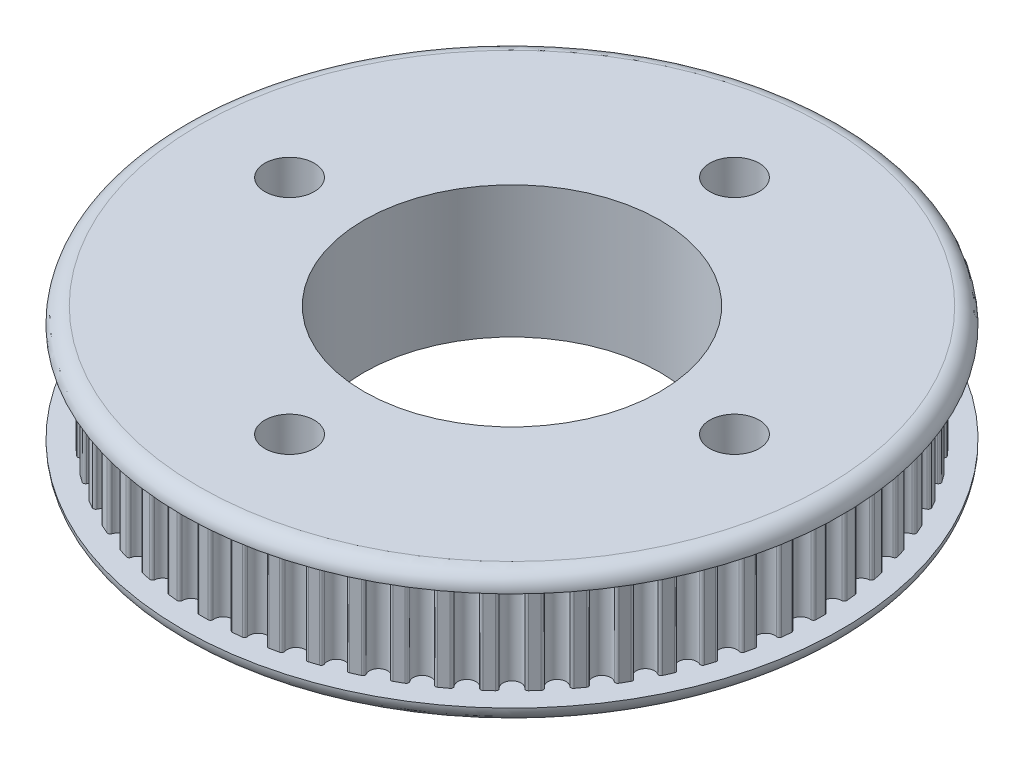
from build123d import *

# Parameters (mm, degrees)
SKETCH1_R           = 19.1
BOSS_EXTRUDE1_DEPTH = 6
CUT_EXTRUDE1_DEPTH  = 6
CIRPATTERN2_DEPTH   = 6
SKETCH3_R           = 1.5
CUT_EXTRUDE2_DEPTH  = 6
SKETCH4_R           = 9
CUT_EXTRUDE3_DEPTH  = 6
SKETCH5_R           = 20
BOSS_EXTRUDE2_DEPTH = 1
FILLET1_R           = 1
SKETCH6_R           = 1.5
SKETCH6_R_2         = 9
CUT_EXTRUDE4_DEPTH  = 1
SKETCH7_R           = 20
BOSS_EXTRUDE3_DEPTH = 1
FILLET2_R           = 1
SKETCH8_R           = 1.5
SKETCH8_R_2         = 9
CUT_EXTRUDE5_DEPTH  = 1


# Read off the part's stored shape, not the designer's step: CirPattern2
with BuildPart() as part:
    # Sketch1 → Boss-Extrude1 (new body)
    with BuildSketch(Plane(origin=(0, 0, 0), x_dir=(1, 0, 0), z_dir=(0, 1, 0))):
        with Locations(Location((0, 0, 0), (0, 0, 270))):
            Circle(SKETCH1_R)
    extrude(amount=BOSS_EXTRUDE1_DEPTH)

    # Sketch2 → Cut-Extrude1 (cut)
    with BuildSketch(Plane(origin=(0, 6, 0), x_dir=(1, 0, 0), z_dir=(0, 1, 0))):
        with BuildLine():
            Line((0, 18.72), (0.273332529, 18.72))
            ThreePointArc((0.273332529, 18.72), (0.384963531, 18.670192412), (0.422460254, 18.553846925))
            ThreePointArc((0.422460254, 18.553846925), (0.940477134, 17.94537274), (1.519259135, 18.496366131))
            ThreePointArc((1.519259135, 18.496366131), (1.568711861, 18.608154791), (1.684937647, 18.646020911))
            Line((1.684937647, 18.646020911), (1.956772832, 18.617449881))
            Line((1.956772832, 18.617449881), (1.996493648, 18.995368202))
            Line((1.996493648, 18.995368202), (1.058746787, 19.07063332))
            Line((1.058746787, 19.07063332), (0.940477134, 19.07683157))
            Line((0.940477134, 19.07683157), (0, 19.1))
            Line((0, 19.1), (0, 18.72))
        make_face()
    extrude(amount=-CUT_EXTRUDE1_DEPTH, mode=Mode.SUBTRACT)


with BuildPart() as cut_extrude1_kept_piece:
    # of the separate pieces the step leaves, the one the design keeps (cut_extrude1_pieces_kept)
    add(part.part.solids().sort_by_distance((0, 0, 19.1))[0])

    # CirPattern2 outline → CirPattern2 (cut)
    with BuildSketch(Plane(origin=(0, 0, 0), x_dir=(1, 0, 0), z_dir=(0, 1, 0))):
        with BuildLine():
            ThreePointArc((-0.422460254, 18.553846925), (-0.384963531, 18.670192412), (-0.273332529, 18.72))
            Line((-0.273332529, 18.72), (0, 18.72))
            Line((0, 18.72), (0, 19.1))
            ThreePointArc((0, 19.1), (-0.999616756, -19.073824114), (1.996493648, 18.995368202))
            Line((1.996493648, 18.995368202), (1.956772832, 18.617449881))
            Line((1.956772832, 18.617449881), (2.228608017, 18.588878852))
            ThreePointArc((2.228608017, 18.588878852), (2.334421183, 18.527675498), (2.359551079, 18.408047889))
            ThreePointArc((2.359551079, 18.408047889), (2.811127337, 17.74875948), (3.444333202, 18.23623528))
            ThreePointArc((3.444333202, 18.23623528), (3.505200118, 18.342242332), (3.624747294, 18.367752114))
            Line((3.624747294, 18.367752114), (4.15946641, 18.254094057))
            ThreePointArc((4.15946641, 18.254094057), (4.258302427, 18.182165494), (4.270790169, 18.060566428))
            ThreePointArc((4.270790169, 18.060566428), (4.650978241, 17.357687098), (5.331670434, 17.776304418))
            ThreePointArc((5.331670434, 17.776304418), (5.403284669, 17.875368427), (5.524843452, 17.888242382))
            Line((5.524843452, 17.888242382), (6.044752818, 17.719313588))
            ThreePointArc((6.044752818, 17.719313588), (6.135528819, 17.63744788), (6.135237588, 17.515209623))
            ThreePointArc((6.135237588, 17.515209623), (6.439872053, 16.776440264), (7.160592769, 17.121612646))
            ThreePointArc((7.160592769, 17.121612646), (7.242169702, 17.212648246), (7.364408268, 17.212745322))
            Line((7.364408268, 17.212745322), (7.863811649, 16.990396612))
            ThreePointArc((7.863811649, 16.990396612), (7.945533073, 16.899490697), (7.93246606, 16.777952515))
            ThreePointArc((7.93246606, 16.777952515), (8.15820928, 16.01138724), (8.911062151, 16.279332902))
            ThreePointArc((8.911062151, 16.279332902), (9.001708008, 16.361342688), (9.123287086, 16.348661824))
            Line((9.123287086, 16.348661824), (9.596712914, 16.075329294))
            ThreePointArc((9.596712914, 16.075329294), (9.668484404, 15.976379156), (9.642784774, 15.856872648))
            ThreePointArc((9.642784774, 15.856872648), (9.787163459, 15.070910106), (10.563900071, 15.25869338))
            ThreePointArc((10.563900071, 15.25869338), (10.662621718, 15.330778836), (10.782209262, 15.305458964))
            Line((10.782209262, 15.305458964), (11.224470584, 14.984137305))
            ThreePointArc((11.224470584, 14.984137305), (11.285505796, 14.878227063), (11.247455121, 14.762061567))
            ThreePointArc((11.247455121, 14.762061567), (11.308887427, 13.965312927), (12.100997692, 14.070876421))
            ThreePointArc((12.100997692, 14.070876421), (12.206713513, 14.132247763), (12.322999296, 14.094566294))
            Line((12.322999296, 14.094566294), (12.729250606, 13.728775972))
            ThreePointArc((12.729250606, 13.728775972), (12.778880826, 13.617066), (12.728895995, 13.505514249))
            ThreePointArc((12.728895995, 13.505514249), (12.706708858, 12.706708858), (13.505514249, 12.728895995))
            ThreePointArc((13.505514249, 12.728895995), (13.617066, 12.778880826), (13.728775972, 12.729250606))
            Line((13.728775972, 12.729250606), (14.094566294, 12.322999296))
            ThreePointArc((14.094566294, 12.322999296), (14.132247763, 12.206713513), (14.070876421, 12.100997692))
            ThreePointArc((14.070876421, 12.100997692), (13.965312927, 11.308887427), (14.762061567, 11.247455121))
            ThreePointArc((14.762061567, 11.247455121), (14.878227063, 11.285505796), (14.984137305, 11.224470584))
            Line((14.984137305, 11.224470584), (15.305458964, 10.782209262))
            ThreePointArc((15.305458964, 10.782209262), (15.330778836, 10.662621718), (15.25869338, 10.563900071))
            ThreePointArc((15.25869338, 10.563900071), (15.070910106, 9.787163459), (15.856872648, 9.642784774))
            ThreePointArc((15.856872648, 9.642784774), (15.976379156, 9.668484404), (16.075329294, 9.596712914))
            Line((16.075329294, 9.596712914), (16.348661824, 9.123287086))
            ThreePointArc((16.348661824, 9.123287086), (16.361342688, 9.001708008), (16.279332902, 8.911062151))
            ThreePointArc((16.279332902, 8.911062151), (16.01138724, 8.15820928), (16.777952515, 7.93246606))
            ThreePointArc((16.777952515, 7.93246606), (16.899490697, 7.945533073), (16.990396612, 7.863811649))
            Line((16.990396612, 7.863811649), (17.212745322, 7.364408268))
            ThreePointArc((17.212745322, 7.364408268), (17.212648246, 7.242169702), (17.121612646, 7.160592769))
            ThreePointArc((17.121612646, 7.160592769), (16.776440264, 6.439872053), (17.515209623, 6.135237588))
            ThreePointArc((17.515209623, 6.135237588), (17.63744788, 6.135528819), (17.719313588, 6.044752818))
            Line((17.719313588, 6.044752818), (17.888242382, 5.524843452))
            ThreePointArc((17.888242382, 5.524843452), (17.875368427, 5.403284669), (17.776304418, 5.331670434))
            ThreePointArc((17.776304418, 5.331670434), (17.357687098, 4.650978241), (18.060566428, 4.270790169))
            ThreePointArc((18.060566428, 4.270790169), (18.182165494, 4.258302427), (18.254094057, 4.15946641))
            Line((18.254094057, 4.15946641), (18.367752114, 3.624747294))
            ThreePointArc((18.367752114, 3.624747294), (18.342242332, 3.505200118), (18.23623528, 3.444333202))
            ThreePointArc((18.23623528, 3.444333202), (17.74875948, 2.811127337), (18.408047889, 2.359551079))
            ThreePointArc((18.408047889, 2.359551079), (18.527675498, 2.334421183), (18.588878852, 2.228608017))
            Line((18.588878852, 2.228608017), (18.646020911, 1.684937647))
            ThreePointArc((18.646020911, 1.684937647), (18.608154791, 1.568711861), (18.496366131, 1.519259135))
            ThreePointArc((18.496366131, 1.519259135), (17.94537274, 0.940477134), (18.553846925, 0.422460254))
            ThreePointArc((18.553846925, 0.422460254), (18.670192412, 0.384963531), (18.72, 0.273332529))
            Line((18.72, 0.273332529), (18.72, -0.273332529))
            ThreePointArc((18.72, -0.273332529), (18.670192412, -0.384963531), (18.553846925, -0.422460254))
            ThreePointArc((18.553846925, -0.422460254), (17.94537274, -0.940477134), (18.496366131, -1.519259135))
            ThreePointArc((18.496366131, -1.519259135), (18.608154791, -1.568711861), (18.646020911, -1.684937647))
            Line((18.646020911, -1.684937647), (18.588878852, -2.228608017))
            ThreePointArc((18.588878852, -2.228608017), (18.527675498, -2.334421183), (18.408047889, -2.359551079))
            ThreePointArc((18.408047889, -2.359551079), (17.74875948, -2.811127337), (18.23623528, -3.444333202))
            ThreePointArc((18.23623528, -3.444333202), (18.342242332, -3.505200118), (18.367752114, -3.624747294))
            Line((18.367752114, -3.624747294), (18.254094057, -4.15946641))
            ThreePointArc((18.254094057, -4.15946641), (18.182165494, -4.258302427), (18.060566428, -4.270790169))
            ThreePointArc((18.060566428, -4.270790169), (17.357687098, -4.650978241), (17.776304418, -5.331670434))
            ThreePointArc((17.776304418, -5.331670434), (17.875368427, -5.403284669), (17.888242382, -5.524843452))
            Line((17.888242382, -5.524843452), (17.719313588, -6.044752818))
            ThreePointArc((17.719313588, -6.044752818), (17.63744788, -6.135528819), (17.515209623, -6.135237588))
            ThreePointArc((17.515209623, -6.135237588), (16.776440264, -6.439872053), (17.121612646, -7.160592769))
            ThreePointArc((17.121612646, -7.160592769), (17.212648246, -7.242169702), (17.212745322, -7.364408268))
            Line((17.212745322, -7.364408268), (16.990396612, -7.863811649))
            ThreePointArc((16.990396612, -7.863811649), (16.899490697, -7.945533073), (16.777952515, -7.93246606))
            ThreePointArc((16.777952515, -7.93246606), (16.01138724, -8.15820928), (16.279332902, -8.911062151))
            ThreePointArc((16.279332902, -8.911062151), (16.361342688, -9.001708008), (16.348661824, -9.123287086))
            Line((16.348661824, -9.123287086), (16.075329294, -9.596712914))
            ThreePointArc((16.075329294, -9.596712914), (15.976379156, -9.668484404), (15.856872648, -9.642784774))
            ThreePointArc((15.856872648, -9.642784774), (15.070910106, -9.787163459), (15.25869338, -10.563900071))
            ThreePointArc((15.25869338, -10.563900071), (15.330778836, -10.662621718), (15.305458964, -10.782209262))
            Line((15.305458964, -10.782209262), (14.984137305, -11.224470584))
            ThreePointArc((14.984137305, -11.224470584), (14.878227063, -11.285505796), (14.762061567, -11.247455121))
            ThreePointArc((14.762061567, -11.247455121), (13.965312927, -11.308887427), (14.070876421, -12.100997692))
            ThreePointArc((14.070876421, -12.100997692), (14.132247763, -12.206713513), (14.094566294, -12.322999296))
            Line((14.094566294, -12.322999296), (13.728775972, -12.729250606))
            ThreePointArc((13.728775972, -12.729250606), (13.617066, -12.778880826), (13.505514249, -12.728895995))
            ThreePointArc((13.505514249, -12.728895995), (12.706708858, -12.706708858), (12.728895995, -13.505514249))
            ThreePointArc((12.728895995, -13.505514249), (12.778880826, -13.617066), (12.729250606, -13.728775972))
            Line((12.729250606, -13.728775972), (12.322999296, -14.094566294))
            ThreePointArc((12.322999296, -14.094566294), (12.206713513, -14.132247763), (12.100997692, -14.070876421))
            ThreePointArc((12.100997692, -14.070876421), (11.308887427, -13.965312927), (11.247455121, -14.762061567))
            ThreePointArc((11.247455121, -14.762061567), (11.285505796, -14.878227063), (11.224470584, -14.984137305))
            Line((11.224470584, -14.984137305), (10.782209262, -15.305458964))
            ThreePointArc((10.782209262, -15.305458964), (10.662621718, -15.330778836), (10.563900071, -15.25869338))
            ThreePointArc((10.563900071, -15.25869338), (9.787163459, -15.070910106), (9.642784774, -15.856872648))
            ThreePointArc((9.642784774, -15.856872648), (9.668484404, -15.976379156), (9.596712914, -16.075329294))
            Line((9.596712914, -16.075329294), (9.123287086, -16.348661824))
            ThreePointArc((9.123287086, -16.348661824), (9.001708008, -16.361342688), (8.911062151, -16.279332902))
            ThreePointArc((8.911062151, -16.279332902), (8.15820928, -16.01138724), (7.93246606, -16.777952515))
            ThreePointArc((7.93246606, -16.777952515), (7.945533073, -16.899490697), (7.863811649, -16.990396612))
            Line((7.863811649, -16.990396612), (7.364408268, -17.212745322))
            ThreePointArc((7.364408268, -17.212745322), (7.242169702, -17.212648246), (7.160592769, -17.121612646))
            ThreePointArc((7.160592769, -17.121612646), (6.439872053, -16.776440264), (6.135237588, -17.515209623))
            ThreePointArc((6.135237588, -17.515209623), (6.135528819, -17.63744788), (6.044752818, -17.719313588))
            Line((6.044752818, -17.719313588), (5.524843452, -17.888242382))
            ThreePointArc((5.524843452, -17.888242382), (5.403284669, -17.875368427), (5.331670434, -17.776304418))
            ThreePointArc((5.331670434, -17.776304418), (4.650978241, -17.357687098), (4.270790169, -18.060566428))
            ThreePointArc((4.270790169, -18.060566428), (4.258302427, -18.182165494), (4.15946641, -18.254094057))
            Line((4.15946641, -18.254094057), (3.624747294, -18.367752114))
            ThreePointArc((3.624747294, -18.367752114), (3.505200118, -18.342242332), (3.444333202, -18.23623528))
            ThreePointArc((3.444333202, -18.23623528), (2.811127337, -17.74875948), (2.359551079, -18.408047889))
            ThreePointArc((2.359551079, -18.408047889), (2.334421183, -18.527675498), (2.228608017, -18.588878852))
            Line((2.228608017, -18.588878852), (1.684937647, -18.646020911))
            ThreePointArc((1.684937647, -18.646020911), (1.568711861, -18.608154791), (1.519259135, -18.496366131))
            ThreePointArc((1.519259135, -18.496366131), (0.940477134, -17.94537274), (0.422460254, -18.553846925))
            ThreePointArc((0.422460254, -18.553846925), (0.384963531, -18.670192412), (0.273332529, -18.72))
            Line((0.273332529, -18.72), (-0.273332529, -18.72))
            ThreePointArc((-0.273332529, -18.72), (-0.384963531, -18.670192412), (-0.422460254, -18.553846925))
            ThreePointArc((-0.422460254, -18.553846925), (-0.940477134, -17.94537274), (-1.519259135, -18.496366131))
            ThreePointArc((-1.519259135, -18.496366131), (-1.568711861, -18.608154791), (-1.684937647, -18.646020911))
            Line((-1.684937647, -18.646020911), (-2.228608017, -18.588878852))
            ThreePointArc((-2.228608017, -18.588878852), (-2.334421183, -18.527675498), (-2.359551079, -18.408047889))
            ThreePointArc((-2.359551079, -18.408047889), (-2.811127337, -17.74875948), (-3.444333202, -18.23623528))
            ThreePointArc((-3.444333202, -18.23623528), (-3.505200118, -18.342242332), (-3.624747294, -18.367752114))
            Line((-3.624747294, -18.367752114), (-4.15946641, -18.254094057))
            ThreePointArc((-4.15946641, -18.254094057), (-4.258302427, -18.182165494), (-4.270790169, -18.060566428))
            ThreePointArc((-4.270790169, -18.060566428), (-4.650978241, -17.357687098), (-5.331670434, -17.776304418))
            ThreePointArc((-5.331670434, -17.776304418), (-5.403284669, -17.875368427), (-5.524843452, -17.888242382))
            Line((-5.524843452, -17.888242382), (-6.044752818, -17.719313588))
            ThreePointArc((-6.044752818, -17.719313588), (-6.135528819, -17.63744788), (-6.135237588, -17.515209623))
            ThreePointArc((-6.135237588, -17.515209623), (-6.439872053, -16.776440264), (-7.160592769, -17.121612646))
            ThreePointArc((-7.160592769, -17.121612646), (-7.242169702, -17.212648246), (-7.364408268, -17.212745322))
            Line((-7.364408268, -17.212745322), (-7.863811649, -16.990396612))
            ThreePointArc((-7.863811649, -16.990396612), (-7.945533073, -16.899490697), (-7.93246606, -16.777952515))
            ThreePointArc((-7.93246606, -16.777952515), (-8.15820928, -16.01138724), (-8.911062151, -16.279332902))
            ThreePointArc((-8.911062151, -16.279332902), (-9.001708008, -16.361342688), (-9.123287086, -16.348661824))
            Line((-9.123287086, -16.348661824), (-9.596712914, -16.075329294))
            ThreePointArc((-9.596712914, -16.075329294), (-9.668484404, -15.976379156), (-9.642784774, -15.856872648))
            ThreePointArc((-9.642784774, -15.856872648), (-9.787163459, -15.070910106), (-10.563900071, -15.25869338))
            ThreePointArc((-10.563900071, -15.25869338), (-10.662621718, -15.330778836), (-10.782209262, -15.305458964))
            Line((-10.782209262, -15.305458964), (-11.224470584, -14.984137305))
            ThreePointArc((-11.224470584, -14.984137305), (-11.285505796, -14.878227063), (-11.247455121, -14.762061567))
            ThreePointArc((-11.247455121, -14.762061567), (-11.308887427, -13.965312927), (-12.100997692, -14.070876421))
            ThreePointArc((-12.100997692, -14.070876421), (-12.206713513, -14.132247763), (-12.322999296, -14.094566294))
            Line((-12.322999296, -14.094566294), (-12.729250606, -13.728775972))
            ThreePointArc((-12.729250606, -13.728775972), (-12.778880826, -13.617066), (-12.728895995, -13.505514249))
            ThreePointArc((-12.728895995, -13.505514249), (-12.706708858, -12.706708858), (-13.505514249, -12.728895995))
            ThreePointArc((-13.505514249, -12.728895995), (-13.617066, -12.778880826), (-13.728775972, -12.729250606))
            Line((-13.728775972, -12.729250606), (-14.094566294, -12.322999296))
            ThreePointArc((-14.094566294, -12.322999296), (-14.132247763, -12.206713513), (-14.070876421, -12.100997692))
            ThreePointArc((-14.070876421, -12.100997692), (-13.965312927, -11.308887427), (-14.762061567, -11.247455121))
            ThreePointArc((-14.762061567, -11.247455121), (-14.878227063, -11.285505796), (-14.984137305, -11.224470584))
            Line((-14.984137305, -11.224470584), (-15.305458964, -10.782209262))
            ThreePointArc((-15.305458964, -10.782209262), (-15.330778836, -10.662621718), (-15.25869338, -10.563900071))
            ThreePointArc((-15.25869338, -10.563900071), (-15.070910106, -9.787163459), (-15.856872648, -9.642784774))
            ThreePointArc((-15.856872648, -9.642784774), (-15.976379156, -9.668484404), (-16.075329294, -9.596712914))
            Line((-16.075329294, -9.596712914), (-16.348661824, -9.123287086))
            ThreePointArc((-16.348661824, -9.123287086), (-16.361342688, -9.001708008), (-16.279332902, -8.911062151))
            ThreePointArc((-16.279332902, -8.911062151), (-16.01138724, -8.15820928), (-16.777952515, -7.93246606))
            ThreePointArc((-16.777952515, -7.93246606), (-16.899490697, -7.945533073), (-16.990396612, -7.863811649))
            Line((-16.990396612, -7.863811649), (-17.212745322, -7.364408268))
            ThreePointArc((-17.212745322, -7.364408268), (-17.212648246, -7.242169702), (-17.121612646, -7.160592769))
            ThreePointArc((-17.121612646, -7.160592769), (-16.776440264, -6.439872053), (-17.515209623, -6.135237588))
            ThreePointArc((-17.515209623, -6.135237588), (-17.63744788, -6.135528819), (-17.719313588, -6.044752818))
            Line((-17.719313588, -6.044752818), (-17.888242382, -5.524843452))
            ThreePointArc((-17.888242382, -5.524843452), (-17.875368427, -5.403284669), (-17.776304418, -5.331670434))
            ThreePointArc((-17.776304418, -5.331670434), (-17.357687098, -4.650978241), (-18.060566428, -4.270790169))
            ThreePointArc((-18.060566428, -4.270790169), (-18.182165494, -4.258302427), (-18.254094057, -4.15946641))
            Line((-18.254094057, -4.15946641), (-18.367752114, -3.624747294))
            ThreePointArc((-18.367752114, -3.624747294), (-18.342242332, -3.505200118), (-18.23623528, -3.444333202))
            ThreePointArc((-18.23623528, -3.444333202), (-17.74875948, -2.811127337), (-18.408047889, -2.359551079))
            ThreePointArc((-18.408047889, -2.359551079), (-18.527675498, -2.334421183), (-18.588878852, -2.228608017))
            Line((-18.588878852, -2.228608017), (-18.646020911, -1.684937647))
            ThreePointArc((-18.646020911, -1.684937647), (-18.608154791, -1.568711861), (-18.496366131, -1.519259135))
            ThreePointArc((-18.496366131, -1.519259135), (-17.94537274, -0.940477134), (-18.553846925, -0.422460254))
            ThreePointArc((-18.553846925, -0.422460254), (-18.670192412, -0.384963531), (-18.72, -0.273332529))
            Line((-18.72, -0.273332529), (-18.72, 0.273332529))
            ThreePointArc((-18.72, 0.273332529), (-18.670192412, 0.384963531), (-18.553846925, 0.422460254))
            ThreePointArc((-18.553846925, 0.422460254), (-17.94537274, 0.940477134), (-18.496366131, 1.519259135))
            ThreePointArc((-18.496366131, 1.519259135), (-18.608154791, 1.568711861), (-18.646020911, 1.684937647))
            Line((-18.646020911, 1.684937647), (-18.588878852, 2.228608017))
            ThreePointArc((-18.588878852, 2.228608017), (-18.527675498, 2.334421183), (-18.408047889, 2.359551079))
            ThreePointArc((-18.408047889, 2.359551079), (-17.74875948, 2.811127337), (-18.23623528, 3.444333202))
            ThreePointArc((-18.23623528, 3.444333202), (-18.342242332, 3.505200118), (-18.367752114, 3.624747294))
            Line((-18.367752114, 3.624747294), (-18.254094057, 4.15946641))
            ThreePointArc((-18.254094057, 4.15946641), (-18.182165494, 4.258302427), (-18.060566428, 4.270790169))
            ThreePointArc((-18.060566428, 4.270790169), (-17.357687098, 4.650978241), (-17.776304418, 5.331670434))
            ThreePointArc((-17.776304418, 5.331670434), (-17.875368427, 5.403284669), (-17.888242382, 5.524843452))
            Line((-17.888242382, 5.524843452), (-17.719313588, 6.044752818))
            ThreePointArc((-17.719313588, 6.044752818), (-17.63744788, 6.135528819), (-17.515209623, 6.135237588))
            ThreePointArc((-17.515209623, 6.135237588), (-16.776440264, 6.439872053), (-17.121612646, 7.160592769))
            ThreePointArc((-17.121612646, 7.160592769), (-17.212648246, 7.242169702), (-17.212745322, 7.364408268))
            Line((-17.212745322, 7.364408268), (-16.990396612, 7.863811649))
            ThreePointArc((-16.990396612, 7.863811649), (-16.899490697, 7.945533073), (-16.777952515, 7.93246606))
            ThreePointArc((-16.777952515, 7.93246606), (-16.01138724, 8.15820928), (-16.279332902, 8.911062151))
            ThreePointArc((-16.279332902, 8.911062151), (-16.361342688, 9.001708008), (-16.348661824, 9.123287086))
            Line((-16.348661824, 9.123287086), (-16.075329294, 9.596712914))
            ThreePointArc((-16.075329294, 9.596712914), (-15.976379156, 9.668484404), (-15.856872648, 9.642784774))
            ThreePointArc((-15.856872648, 9.642784774), (-15.070910106, 9.787163459), (-15.25869338, 10.563900071))
            ThreePointArc((-15.25869338, 10.563900071), (-15.330778836, 10.662621718), (-15.305458964, 10.782209262))
            Line((-15.305458964, 10.782209262), (-14.984137305, 11.224470584))
            ThreePointArc((-14.984137305, 11.224470584), (-14.878227063, 11.285505796), (-14.762061567, 11.247455121))
            ThreePointArc((-14.762061567, 11.247455121), (-13.965312927, 11.308887427), (-14.070876421, 12.100997692))
            ThreePointArc((-14.070876421, 12.100997692), (-14.132247763, 12.206713513), (-14.094566294, 12.322999296))
            Line((-14.094566294, 12.322999296), (-13.728775972, 12.729250606))
            ThreePointArc((-13.728775972, 12.729250606), (-13.617066, 12.778880826), (-13.505514249, 12.728895995))
            ThreePointArc((-13.505514249, 12.728895995), (-12.706708858, 12.706708858), (-12.728895995, 13.505514249))
            ThreePointArc((-12.728895995, 13.505514249), (-12.778880826, 13.617066), (-12.729250606, 13.728775972))
            Line((-12.729250606, 13.728775972), (-12.322999296, 14.094566294))
            ThreePointArc((-12.322999296, 14.094566294), (-12.206713513, 14.132247763), (-12.100997692, 14.070876421))
            ThreePointArc((-12.100997692, 14.070876421), (-11.308887427, 13.965312927), (-11.247455121, 14.762061567))
            ThreePointArc((-11.247455121, 14.762061567), (-11.285505796, 14.878227063), (-11.224470584, 14.984137305))
            Line((-11.224470584, 14.984137305), (-10.782209262, 15.305458964))
            ThreePointArc((-10.782209262, 15.305458964), (-10.662621718, 15.330778836), (-10.563900071, 15.25869338))
            ThreePointArc((-10.563900071, 15.25869338), (-9.787163459, 15.070910106), (-9.642784774, 15.856872648))
            ThreePointArc((-9.642784774, 15.856872648), (-9.668484404, 15.976379156), (-9.596712914, 16.075329294))
            Line((-9.596712914, 16.075329294), (-9.123287086, 16.348661824))
            ThreePointArc((-9.123287086, 16.348661824), (-9.001708008, 16.361342688), (-8.911062151, 16.279332902))
            ThreePointArc((-8.911062151, 16.279332902), (-8.15820928, 16.01138724), (-7.93246606, 16.777952515))
            ThreePointArc((-7.93246606, 16.777952515), (-7.945533073, 16.899490697), (-7.863811649, 16.990396612))
            Line((-7.863811649, 16.990396612), (-7.364408268, 17.212745322))
            ThreePointArc((-7.364408268, 17.212745322), (-7.242169702, 17.212648246), (-7.160592769, 17.121612646))
            ThreePointArc((-7.160592769, 17.121612646), (-6.439872053, 16.776440264), (-6.135237588, 17.515209623))
            ThreePointArc((-6.135237588, 17.515209623), (-6.135528819, 17.63744788), (-6.044752818, 17.719313588))
            Line((-6.044752818, 17.719313588), (-5.524843452, 17.888242382))
            ThreePointArc((-5.524843452, 17.888242382), (-5.403284669, 17.875368427), (-5.331670434, 17.776304418))
            ThreePointArc((-5.331670434, 17.776304418), (-4.650978241, 17.357687098), (-4.270790169, 18.060566428))
            ThreePointArc((-4.270790169, 18.060566428), (-4.258302427, 18.182165494), (-4.15946641, 18.254094057))
            Line((-4.15946641, 18.254094057), (-3.624747294, 18.367752114))
            ThreePointArc((-3.624747294, 18.367752114), (-3.505200118, 18.342242332), (-3.444333202, 18.23623528))
            ThreePointArc((-3.444333202, 18.23623528), (-2.811127337, 17.74875948), (-2.359551079, 18.408047889))
            ThreePointArc((-2.359551079, 18.408047889), (-2.334421183, 18.527675498), (-2.228608017, 18.588878852))
            Line((-2.228608017, 18.588878852), (-1.684937647, 18.646020911))
            ThreePointArc((-1.684937647, 18.646020911), (-1.568711861, 18.608154791), (-1.519259135, 18.496366131))
            ThreePointArc((-1.519259135, 18.496366131), (-0.940477134, 17.94537274), (-0.422460254, 18.553846925))
        make_face()
    extrude(amount=CIRPATTERN2_DEPTH, mode=Mode.SUBTRACT)

    # Sketch3 → Cut-Extrude2 (cut)
    with BuildSketch(Plane(origin=(0, 6, 0), x_dir=(1, 0, 0), z_dir=(0, 1, 0))):
        with Locations(Location((0, 13.5, 0), (0, 0, 270))):
            Circle(SKETCH3_R)
        with Locations(Location((13.5, 0, 0), (0, 0, 270))):
            Circle(SKETCH3_R)
        with Locations(Location((-13.5, 0, 0), (0, 0, 270))):
            Circle(SKETCH3_R)
        with Locations(Location((0, -13.5, 0), (0, 0, 270))):
            Circle(SKETCH3_R)
    extrude(amount=-CUT_EXTRUDE2_DEPTH, mode=Mode.SUBTRACT)

    # Sketch4 → Cut-Extrude3 (cut)
    with BuildSketch(Plane(origin=(0, 6, 0), x_dir=(1, 0, 0), z_dir=(0, 1, 0))):
        with Locations(Location((0, 0, 0), (0, 0, 270))):
            Circle(SKETCH4_R)
    extrude(amount=-CUT_EXTRUDE3_DEPTH, mode=Mode.SUBTRACT)

    # Sketch5 → Boss-Extrude2 (add)
    with BuildSketch(Plane(origin=(0, 6, 0), x_dir=(1, 0, 0), z_dir=(0, 1, 0))):
        with Locations(Location((0, 0, 0), (0, 0, 270))):
            Circle(SKETCH5_R)
    extrude(amount=BOSS_EXTRUDE2_DEPTH)

    # Fillet1
    fillet1_edges = [cut_extrude1_kept_piece.edges().sort_by_distance(p)[0] for p in [
        (0, 7, -20),
    ]]
    fillet(fillet1_edges, radius=FILLET1_R - 0.0001)  # a hair under: the kernel refuses the full size

    # Sketch6 → Cut-Extrude4 (cut)
    with BuildSketch(Plane.XZ.offset(-6)):
        with Locations(Location((0, -13.5, 0), (0, 0, 90))):
            Circle(SKETCH6_R)
        with Locations(Location((13.5, 0, 0), (0, 0, 90))):
            Circle(SKETCH6_R)
        with Locations(Location((-13.5, 0, 0), (0, 0, 90))):
            Circle(SKETCH6_R)
        with Locations(Location((0, 0, 0), (0, 0, 90))):
            Circle(SKETCH6_R_2)
        with Locations(Location((0, 13.5, 0), (0, 0, 90))):
            Circle(SKETCH6_R)
    extrude(amount=-CUT_EXTRUDE4_DEPTH, mode=Mode.SUBTRACT)

    # Sketch7 → Boss-Extrude3 (add)
    with BuildSketch(Plane.XZ):
        with Locations(Location((0, 0, 0), (0, 0, 270))):
            Circle(SKETCH7_R)
    extrude(amount=BOSS_EXTRUDE3_DEPTH)

    # Fillet2
    fillet2_edges = [cut_extrude1_kept_piece.edges().sort_by_distance(p)[0] for p in [
        (0, -1, 20),
    ]]
    fillet(fillet2_edges, radius=FILLET2_R - 0.0001)  # a hair under: the kernel refuses the full size

    # Sketch8 → Cut-Extrude5 (cut)
    with BuildSketch(Plane(origin=(0, 0, 0), x_dir=(1, 0, 0), z_dir=(0, 1, 0))):
        with Locations(Location((0, -13.5, 0), (0, 0, 270))):
            Circle(SKETCH8_R)
        with Locations(Location((13.5, 0, 0), (0, 0, 270))):
            Circle(SKETCH8_R)
        with Locations(Location((0, 13.5, 0), (0, 0, 270))):
            Circle(SKETCH8_R)
        with Locations(Location((0, 0, 0), (0, 0, 270))):
            Circle(SKETCH8_R_2)
        with Locations(Location((-13.5, 0, 0), (0, 0, 270))):
            Circle(SKETCH8_R)
    extrude(amount=-CUT_EXTRUDE5_DEPTH, mode=Mode.SUBTRACT)


solid = cut_extrude1_kept_piece.part
